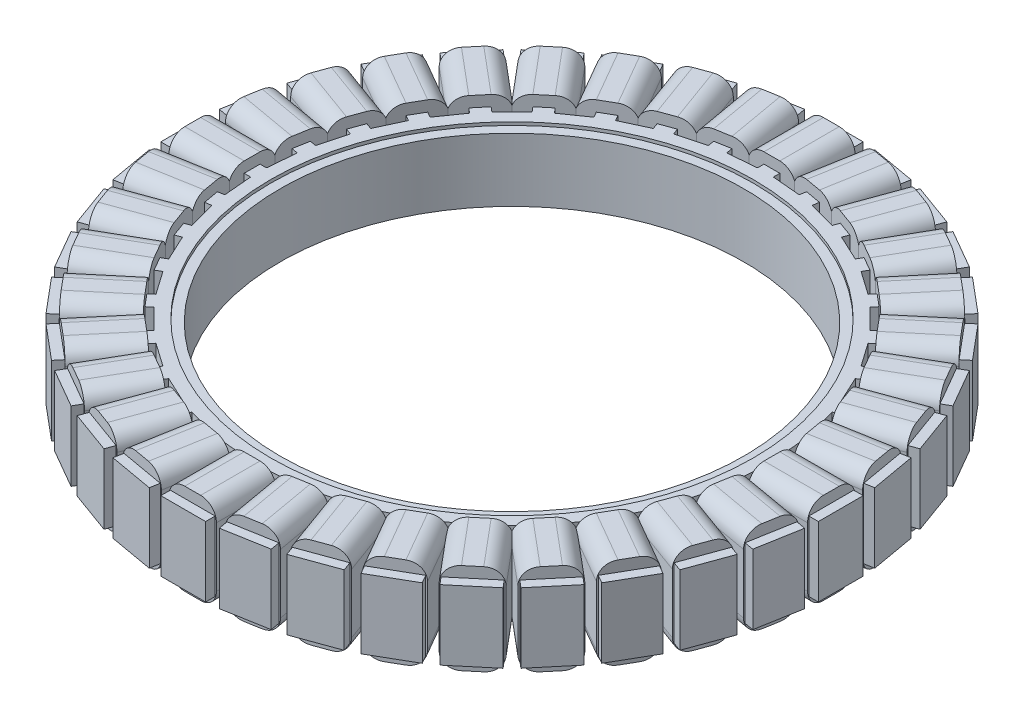
from build123d import *

# Parameters (mm, degrees)
SKETCH1_R           = 30.45
SKETCH1_R_2         = 29.25
BOSS_EXTRUDE1_DEPTH = 4
SKETCH2_R           = 30.45
BOSS_EXTRUDE2_DEPTH = 4.4
CUT_EXTRUDE1_DEPTH  = 8.8
BOSS_EXTRUDE3_DEPTH = 7.5
CIRPATTERN1_COUNT   = 36


with BuildPart() as part:
    # Sketch1 → Boss-Extrude1 (new, symmetric)
    with BuildSketch(Plane(origin=(0, 0, 0), x_dir=(1, 0, 0), z_dir=(0, 1, 0))):
        with Locations(Location((0, 0, 0), (0, 0, 270))):
            Circle(SKETCH1_R)
        with Locations(Location((0, 0, 0), (0, 0, 270))):
            Circle(SKETCH1_R_2, mode=Mode.SUBTRACT)
    extrude(amount=BOSS_EXTRUDE1_DEPTH, both=True)

    # Sketch2 → Boss-Extrude2 (add, symmetric)
    with BuildSketch(Plane(origin=(0, 0, 0), x_dir=(1, 0, 0), z_dir=(0, 1, 0))):
        Polygon((-3.630779536, 41.5), (-10.78201921, 40.2390435), (-17.605652686, 37.755444025), (-23.894347314, 34.124664489), (-29.45702429, 29.45702429), (-34.124664489, 23.894347314), (-37.755444025, 17.605652686), (-40.2390435, 10.78201921), (-41.5, 3.630779536), (-41.5, -3.630779536), (-40.2390435, -10.78201921), (-37.755444025, -17.605652686), (-34.124664489, -23.894347314), (-29.45702429, -29.45702429), (-23.894347314, -34.124664489), (-17.605652686, -37.755444025), (-10.78201921, -40.2390435), (-3.630779536, -41.5), (3.630779536, -41.5), (10.78201921, -40.2390435), (17.605652686, -37.755444025), (23.894347314, -34.124664489), (29.45702429, -29.45702429), (34.124664489, -23.894347314), (37.755444025, -17.605652686), (40.2390435, -10.78201921), (41.5, -3.630779536), (41.5, 3.630779536), (40.2390435, 10.78201921), (37.755444025, 17.605652686), (34.124664489, 23.894347314), (29.45702429, 29.45702429), (23.894347314, 34.124664489), (17.605652686, 37.755444025), (10.78201921, 40.2390435), (3.630779536, 41.5), align=None)
        with Locations(Location((0, 0, 0), (0, 0, 270))):
            Circle(SKETCH2_R, mode=Mode.SUBTRACT)
    extrude(amount=BOSS_EXTRUDE2_DEPTH, both=True)

    # Sketch4 → Cut-Extrude1 (cut)
    with BuildSketch(Plane(origin=(0, 4.4, 0), x_dir=(1, 0, 0), z_dir=(0, 1, 0))):
        Polygon((1, 40.3), (2.827723666, 40.3), (2.827723666, 41.5), (3.630779536, 41.5), (4.421635183, 41.360550812), (4.21325737, 40.178781508), (6.013213807, 39.861400624), (4.569251962, 31.672286062), (1, 31.984555146), align=None)
        Polygon((7.982829313, 39.514104269), (9.78278575, 39.196723385), (9.991163563, 40.378492688), (10.78201921, 40.2390435), (11.536644885, 39.964382216), (11.126220713, 38.836751071), (12.843719155, 38.211632761), (9.999669514, 30.397670593), (6.538867468, 31.324989707), align=None)
        Polygon((14.723104397, 37.527592474), (16.440602839, 36.902474164), (16.851027011, 38.030105309), (17.605652686, 37.755444025), (18.30111947, 37.35391609), (17.70111947, 36.314685606), (19.283974596, 35.400823773), (15.126252169, 28.199437285), (11.879054756, 29.713630306), align=None)
        Polygon((21.016025404, 34.400823773), (22.59888053, 33.486961939), (23.19888053, 34.526192424), (23.894347314, 34.124664489), (24.509523801, 33.608470126), (23.738178669, 32.689216794), (25.138296227, 31.514378667), (19.793231306, 25.144378345), (16.858302977, 27.199437285), align=None)
        Polygon((26.670385113, 30.228803448), (28.070502672, 29.053965321), (28.841847803, 29.973218653), (29.45702429, 29.45702429), (29.973218653, 28.841847803), (29.053965321, 28.070502672), (30.228803448, 26.670385113), (23.858803126, 21.325320192), (21.325320192, 23.858803126), align=None)
        Polygon((31.514378667, 25.138296227), (32.689216794, 23.738178669), (33.608470126, 24.509523801), (34.124664489, 23.894347314), (34.526192424, 23.19888053), (33.486961939, 22.59888053), (34.400823773, 21.016025404), (27.199437285, 16.858302977), (25.144378345, 19.793231306), align=None)
        Polygon((35.400823773, 19.283974596), (36.314685606, 17.70111947), (37.35391609, 18.30111947), (37.755444025, 17.605652686), (38.030105309, 16.851027011), (36.902474164, 16.440602839), (37.527592474, 14.723104397), (29.713630306, 11.879054756), (28.199437285, 15.126252169), align=None)
        Polygon((38.211632761, 12.843719155), (38.836751071, 11.126220713), (39.964382216, 11.536644885), (40.2390435, 10.78201921), (40.378492688, 9.991163563), (39.196723385, 9.78278575), (39.514104269, 7.982829313), (31.324989707, 6.538867468), (30.397670593, 9.999669514), align=None)
        Polygon((39.861400624, 6.013213807), (40.178781508, 4.21325737), (41.360550812, 4.421635183), (41.5, 3.630779536), (41.5, 2.827723666), (40.3, 2.827723666), (40.3, 1), (31.984555146, 1), (31.672286062, 4.569251962), align=None)
        Polygon((40.3, -1), (40.3, -2.827723666), (41.5, -2.827723666), (41.5, -3.630779536), (41.360550812, -4.421635183), (40.178781508, -4.21325737), (39.861400624, -6.013213807), (31.672286062, -4.569251962), (31.984555146, -1), align=None)
        Polygon((39.514104269, -7.982829313), (39.196723385, -9.78278575), (40.378492688, -9.991163563), (40.2390435, -10.78201921), (39.964382216, -11.536644885), (38.836751071, -11.126220713), (38.211632761, -12.843719155), (30.397670593, -9.999669514), (31.324989707, -6.538867468), align=None)
        Polygon((37.527592474, -14.723104397), (36.902474164, -16.440602839), (38.030105309, -16.851027011), (37.755444025, -17.605652686), (37.35391609, -18.30111947), (36.314685606, -17.70111947), (35.400823773, -19.283974596), (28.199437285, -15.126252169), (29.713630306, -11.879054756), align=None)
        Polygon((34.400823773, -21.016025404), (33.486961939, -22.59888053), (34.526192424, -23.19888053), (34.124664489, -23.894347314), (33.608470126, -24.509523801), (32.689216794, -23.738178669), (31.514378667, -25.138296227), (25.144378345, -19.793231306), (27.199437285, -16.858302977), align=None)
        Polygon((30.228803448, -26.670385113), (29.053965321, -28.070502672), (29.973218653, -28.841847803), (29.45702429, -29.45702429), (28.841847803, -29.973218653), (28.070502672, -29.053965321), (26.670385113, -30.228803448), (21.325320192, -23.858803126), (23.858803126, -21.325320192), align=None)
        Polygon((25.138296227, -31.514378667), (23.738178669, -32.689216794), (24.509523801, -33.608470126), (23.894347314, -34.124664489), (23.19888053, -34.526192424), (22.59888053, -33.486961939), (21.016025404, -34.400823773), (16.858302977, -27.199437285), (19.793231306, -25.144378345), align=None)
        Polygon((19.283974596, -35.400823773), (17.70111947, -36.314685606), (18.30111947, -37.35391609), (17.605652686, -37.755444025), (16.851027011, -38.030105309), (16.440602839, -36.902474164), (14.723104397, -37.527592474), (11.879054756, -29.713630306), (15.126252169, -28.199437285), align=None)
        Polygon((12.843719155, -38.211632761), (11.126220713, -38.836751071), (11.536644885, -39.964382216), (10.78201921, -40.2390435), (9.991163563, -40.378492688), (9.78278575, -39.196723385), (7.982829313, -39.514104269), (6.538867468, -31.324989707), (9.999669514, -30.397670593), align=None)
        Polygon((6.013213807, -39.861400624), (4.21325737, -40.178781508), (4.421635183, -41.360550812), (3.630779536, -41.5), (2.827723666, -41.5), (2.827723666, -40.3), (1, -40.3), (1, -31.984555146), (4.569251962, -31.672286062), align=None)
        Polygon((-1, -40.3), (-2.827723666, -40.3), (-2.827723666, -41.5), (-3.630779536, -41.5), (-4.421635183, -41.360550812), (-4.21325737, -40.178781508), (-6.013213807, -39.861400624), (-4.569251962, -31.672286062), (-1, -31.984555146), align=None)
        Polygon((-7.982829313, -39.514104269), (-9.78278575, -39.196723385), (-9.991163563, -40.378492688), (-10.78201921, -40.2390435), (-11.536644885, -39.964382216), (-11.126220713, -38.836751071), (-12.843719155, -38.211632761), (-9.999669514, -30.397670593), (-6.538867468, -31.324989707), align=None)
        Polygon((-14.723104397, -37.527592474), (-16.440602839, -36.902474164), (-16.851027011, -38.030105309), (-17.605652686, -37.755444025), (-18.30111947, -37.35391609), (-17.70111947, -36.314685606), (-19.283974596, -35.400823773), (-15.126252169, -28.199437285), (-11.879054756, -29.713630306), align=None)
        Polygon((-21.016025404, -34.400823773), (-22.59888053, -33.486961939), (-23.19888053, -34.526192424), (-23.894347314, -34.124664489), (-24.509523801, -33.608470126), (-23.738178669, -32.689216794), (-25.138296227, -31.514378667), (-19.793231306, -25.144378345), (-16.858302977, -27.199437285), align=None)
        Polygon((-26.670385113, -30.228803448), (-28.070502672, -29.053965321), (-28.841847803, -29.973218653), (-29.45702429, -29.45702429), (-29.973218653, -28.841847803), (-29.053965321, -28.070502672), (-30.228803448, -26.670385113), (-23.858803126, -21.325320192), (-21.325320192, -23.858803126), align=None)
        Polygon((-31.514378667, -25.138296227), (-32.689216794, -23.738178669), (-33.608470126, -24.509523801), (-34.124664489, -23.894347314), (-34.526192424, -23.19888053), (-33.486961939, -22.59888053), (-34.400823773, -21.016025404), (-27.199437285, -16.858302977), (-25.144378345, -19.793231306), align=None)
        Polygon((-35.400823773, -19.283974596), (-36.314685606, -17.70111947), (-37.35391609, -18.30111947), (-37.755444025, -17.605652686), (-38.030105309, -16.851027011), (-36.902474164, -16.440602839), (-37.527592474, -14.723104397), (-29.713630306, -11.879054756), (-28.199437285, -15.126252169), align=None)
        Polygon((-38.211632761, -12.843719155), (-38.836751071, -11.126220713), (-39.964382216, -11.536644885), (-40.2390435, -10.78201921), (-40.378492688, -9.991163563), (-39.196723385, -9.78278575), (-39.514104269, -7.982829313), (-31.324989707, -6.538867468), (-30.397670593, -9.999669514), align=None)
        Polygon((-39.861400624, -6.013213807), (-40.178781508, -4.21325737), (-41.360550812, -4.421635183), (-41.5, -3.630779536), (-41.5, -2.827723666), (-40.3, -2.827723666), (-40.3, -1), (-31.984555146, -1), (-31.672286062, -4.569251962), align=None)
        Polygon((-40.3, 1), (-40.3, 2.827723666), (-41.5, 2.827723666), (-41.5, 3.630779536), (-41.360550812, 4.421635183), (-40.178781508, 4.21325737), (-39.861400624, 6.013213807), (-31.672286062, 4.569251962), (-31.984555146, 1), align=None)
        Polygon((-39.514104269, 7.982829313), (-39.196723385, 9.78278575), (-40.378492688, 9.991163563), (-40.2390435, 10.78201921), (-39.964382216, 11.536644885), (-38.836751071, 11.126220713), (-38.211632761, 12.843719155), (-30.397670593, 9.999669514), (-31.324989707, 6.538867468), align=None)
        Polygon((-37.527592474, 14.723104397), (-36.902474164, 16.440602839), (-38.030105309, 16.851027011), (-37.755444025, 17.605652686), (-37.35391609, 18.30111947), (-36.314685606, 17.70111947), (-35.400823773, 19.283974596), (-28.199437285, 15.126252169), (-29.713630306, 11.879054756), align=None)
        Polygon((-34.400823773, 21.016025404), (-33.486961939, 22.59888053), (-34.526192424, 23.19888053), (-34.124664489, 23.894347314), (-33.608470126, 24.509523801), (-32.689216794, 23.738178669), (-31.514378667, 25.138296227), (-25.144378345, 19.793231306), (-27.199437285, 16.858302977), align=None)
        Polygon((-30.228803448, 26.670385113), (-29.053965321, 28.070502672), (-29.973218653, 28.841847803), (-29.45702429, 29.45702429), (-28.841847803, 29.973218653), (-28.070502672, 29.053965321), (-26.670385113, 30.228803448), (-21.325320192, 23.858803126), (-23.858803126, 21.325320192), align=None)
        Polygon((-25.138296227, 31.514378667), (-23.738178669, 32.689216794), (-24.509523801, 33.608470126), (-23.894347314, 34.124664489), (-23.19888053, 34.526192424), (-22.59888053, 33.486961939), (-21.016025404, 34.400823773), (-16.858302977, 27.199437285), (-19.793231306, 25.144378345), align=None)
        Polygon((-19.283974596, 35.400823773), (-17.70111947, 36.314685606), (-18.30111947, 37.35391609), (-17.605652686, 37.755444025), (-16.851027011, 38.030105309), (-16.440602839, 36.902474164), (-14.723104397, 37.527592474), (-11.879054756, 29.713630306), (-15.126252169, 28.199437285), align=None)
        Polygon((-12.843719155, 38.211632761), (-11.126220713, 38.836751071), (-11.536644885, 39.964382216), (-10.78201921, 40.2390435), (-9.991163563, 40.378492688), (-9.78278575, 39.196723385), (-7.982829313, 39.514104269), (-6.538867468, 31.324989707), (-9.999669514, 30.397670593), align=None)
        Polygon((-6.013213807, 39.861400624), (-4.21325737, 40.178781508), (-4.421635183, 41.360550812), (-3.630779536, 41.5), (-2.827723666, 41.5), (-2.827723666, 40.3), (-1, 40.3), (-1, 31.984555146), (-4.569251962, 31.672286062), align=None)
    extrude(amount=-CUT_EXTRUDE1_DEPTH, mode=Mode.SUBTRACT)

    # Sketch5 → Boss-Extrude3 (add)
    with BuildSketch(Plane.XY.offset(-40.3)):
        with BuildLine():
            Line((1, 5.75), (-1, 5.75))
            ThreePointArc((-1, 5.75), (-2.414213562, 5.164213562), (-3, 3.75))
            Line((-3, 3.75), (-3, -3.75))
            ThreePointArc((-3, -3.75), (-2.414213562, -5.164213562), (-1, -5.75))
            Line((-1, -5.75), (1, -5.75))
            ThreePointArc((1, -5.75), (2.414213562, -5.164213562), (3, -3.75))
            Line((3, -3.75), (3, 3.75))
            ThreePointArc((3, 3.75), (2.414213562, 5.164213562), (1, 5.75))
        make_face()
    boss_extrude3 = extrude(amount=BOSS_EXTRUDE3_DEPTH)

    # CirPattern1: Boss-Extrude3 ×36 about axis
    cirpattern1_axis = Axis((0, 0, 0), (0, 1, 0))
    for i in range(1, CIRPATTERN1_COUNT):
        add(boss_extrude3.rotate(cirpattern1_axis, i * 360 / CIRPATTERN1_COUNT))


solid = part.part
